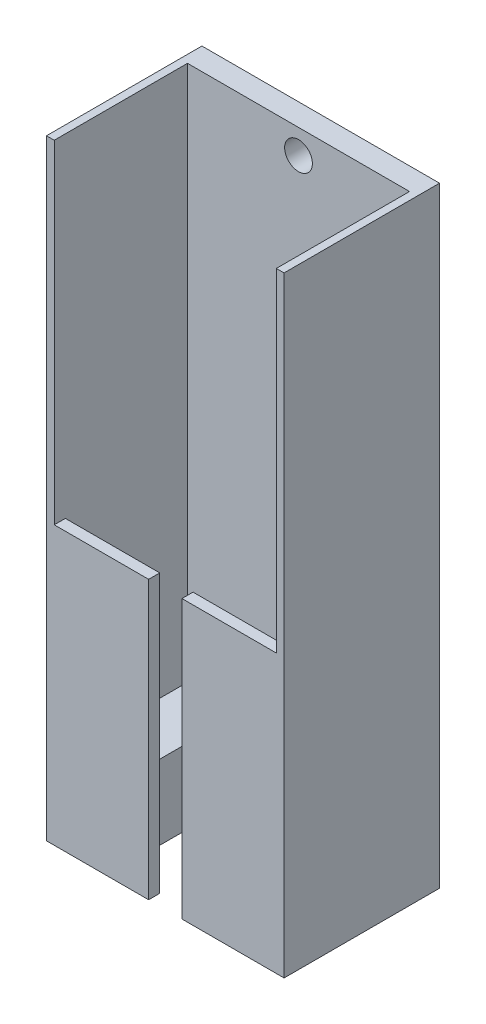
from build123d import *

# Parameters (mm, degrees)
SKETCH1_W           = 54.356
SKETCH1_H           = 139.7
BOSS_EXTRUDE1_DEPTH = 35.56
CUT_EXTRUDE1_DEPTH  = 27.94
CUT_EXTRUDE6_DEPTH  = 30.48
SKETCH4_R           = 3.175
CUT_EXTRUDE7_DEPTH  = 155.062254741


with BuildPart() as part:
    # Sketch1 → Boss-Extrude1 (new body)
    with BuildSketch(Plane.XY):
        with Locations((27.178, -69.85)):
            Rectangle(SKETCH1_W, SKETCH1_H)
    extrude(amount=BOSS_EXTRUDE1_DEPTH)

    # Sketch2 → Cut-Extrude1 (cut)
    with BuildSketch(Plane(origin=(0, 0, 5.08), x_dir=(-1, 0, 0), z_dir=(0, 0, -1))):
        Polygon((-1.778, -33.02), (-52.578, -33.02), (-52.578, -122.6312), (-40.513, -122.6312), (-40.513, -139.7), (-13.843, -139.7), (-13.843, -122.6312), (-1.778, -122.6312), align=None)
    extrude(amount=-CUT_EXTRUDE1_DEPTH, mode=Mode.SUBTRACT)

    # Sketch3 → Cut-Extrude6 (cut)
    with BuildSketch(Plane.XY.offset(35.56)):
        Polygon((23.368, -139.7), (30.988, -139.7), (30.988, -76.2), (52.578, -76.2), (52.578, 0), (1.778, 0), (1.778, -76.2), (23.368, -76.2), align=None)
    extrude(amount=-CUT_EXTRUDE6_DEPTH, mode=Mode.SUBTRACT)

    # Sketch4 → Cut-Extrude7 (cut, through all)
    with BuildSketch(Plane(origin=(0, 0, 0), x_dir=(-1, 0, 0), z_dir=(0, 0, -1))):
        with Locations((-27.178, -5.588)):
            Circle(SKETCH4_R)
    extrude(amount=-CUT_EXTRUDE7_DEPTH, mode=Mode.SUBTRACT)


solid = part.part
